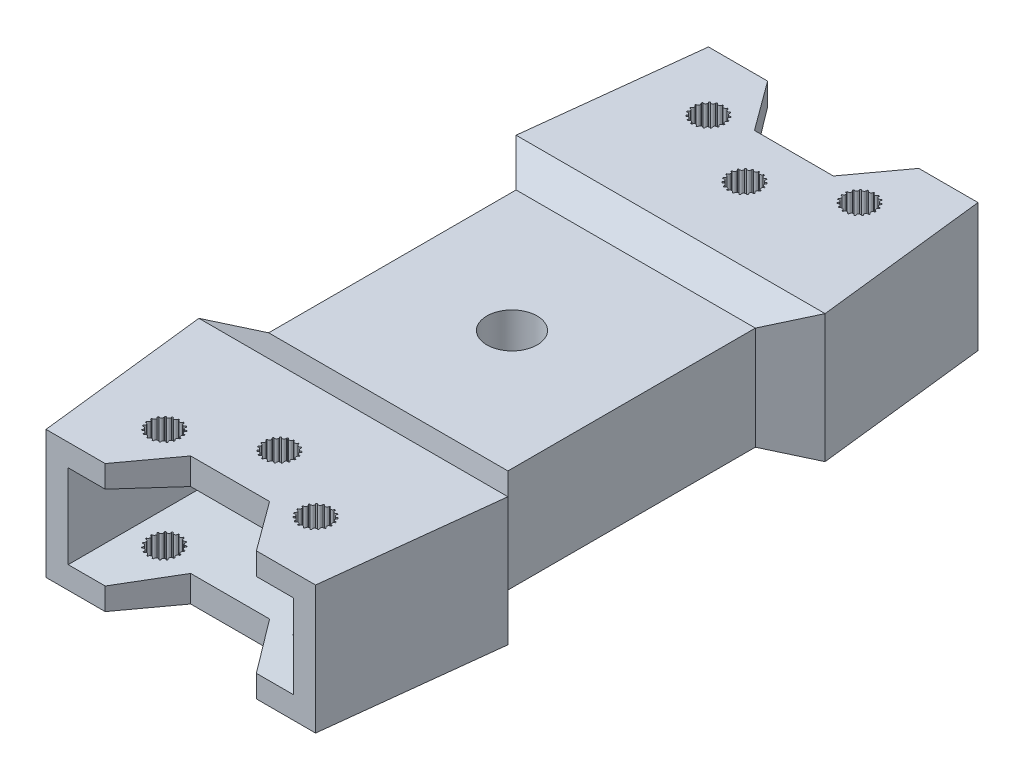
from build123d import *

# Parameters (mm, degrees)
SKETCH2_R               = 3
SKETCH2_R_2             = 5.1
BOSS_EXTRUDE1_DEPTH     = 26
SKETCH3_W               = 70
SKETCH3_H               = 16
CUT_EXTRUDE1_DEPTH      = 27.5
CUT_EXTRUDE2_DEPTH      = 63
SKETCH9_R               = 2
CUT_EXTRUDE3_DEPTH      = 68
SKETCH10_W              = 45.651038986
SKETCH10_H              = 17
CUT_EXTRUDE4_DEPTH      = 28
CUT_EXTRUDE4_DRAFT      = -5
MIRROR5_COPY_1_SKETCH_W = 45.651038986
MIRROR5_COPY_1_SKETCH_H = 17
MIRROR5_COPY_1_DEPTH    = 28
MIRROR5_COPY_1_DRAFT    = -5
CUT_EXTRUDE5_START      = -54
SKETCH11_R              = 2
CUT_EXTRUDE5_DEPTH      = 54
SKETCH12_R              = 8.5
CUT_EXTRUDE6_DEPTH      = 10


with BuildPart() as part:
    # Sketch2 → Boss-Extrude1 (new body)
    with BuildSketch(Plane(origin=(0, 0, 0), x_dir=(1, 0, 0), z_dir=(0, 1, 0))):
        with BuildLine():
            ThreePointArc((15, 350), (0, 365), (-15, 350))
            Line((-15, 350), (-31.325519493, 207.151704434))
            Line((-31.325519493, 207.151704434), (-24.254451681, 200.080636622))
            Line((-24.254451681, 200.080636622), (-24.254451681, 149.919363378))
            Line((-24.254451681, 149.919363378), (-31.325519493, 142.848295566))
            Line((-31.325519493, 142.848295566), (-15, 0))
            ThreePointArc((-15, 0), (0, -15), (15, 0))
            Line((15, 0), (31.325519493, 142.848295566))
            Line((31.325519493, 142.848295566), (24.254451681, 149.919363378))
            Line((24.254451681, 149.919363378), (24.254451681, 200.080636622))
            Line((24.254451681, 200.080636622), (31.325519493, 207.151704434))
            Line((31.325519493, 207.151704434), (15, 350))
        make_face()
        Circle(SKETCH2_R, mode=Mode.SUBTRACT)
        with Locations((0, 175)):
            Circle(SKETCH2_R_2, mode=Mode.SUBTRACT)
        with Locations((0, 350)):
            Circle(SKETCH2_R, mode=Mode.SUBTRACT)
    extrude(amount=BOSS_EXTRUDE1_DEPTH)

    # Sketch3 → Cut-Extrude1 (cut, symmetric)
    with BuildSketch(Plane(origin=(0, 0, 0), x_dir=(0, 0, -1), z_dir=(1, 0, 0))):
        with Locations((-15, 13)):
            Rectangle(SKETCH3_W, SKETCH3_H)
    cut_extrude1 = extrude(amount=CUT_EXTRUDE1_DEPTH, both=True, mode=Mode.SUBTRACT)

    # Sketch5 → Cut-Extrude2 (cut, symmetric)
    with BuildSketch(Plane(origin=(24.254451681, 0, 0), x_dir=(0, 0, -1), z_dir=(1, 0, 0))):
        Polygon((142.848295566, 26), (149.919363378, 23.456766037), (200.080636622, 23.456766037), (207.151704434, 26), align=None)
        Polygon((207.151704434, 0), (200.080636622, 2.543233963), (149.919363378, 2.543233963), (142.848295566, 0), align=None)
    extrude(amount=CUT_EXTRUDE2_DEPTH, both=True, mode=Mode.SUBTRACT)

    # Mirror3: Cut-Extrude1 across plane
    add(cut_extrude1.mirror(Plane.XY.offset(-175)), mode=Mode.SUBTRACT)

    # Sketch9 → Cut-Extrude3 (cut, symmetric)
    with BuildSketch(Plane(origin=(0, 23.456766037, 0), x_dir=(1, 0, 0), z_dir=(0, 1, 0))):
        with Locations((0, 127.848295566)):
            Circle(SKETCH9_R)
        with Locations((-15.325519493, 119.848295566)):
            Circle(SKETCH9_R)
        with Locations((15.325519493, 119.848295566)):
            Circle(SKETCH9_R)
        Polygon((-27.325519493, 107.848295566), (-15.325519493, 107.848295566), (-8, 117.848295566), (8, 117.848295566), (15.325519493, 107.848295566), (27.325519493, 107.848295566), (32.660886482, 107.848295566), (15.941481629, -24.730405263), (-17.738358912, -19.447293022), (-31.029707264, 97.91851296), align=None)
    cut_extrude3 = extrude(amount=CUT_EXTRUDE3_DEPTH, both=True, mode=Mode.SUBTRACT)


with BuildPart() as cut_extrude4_tool:
    # Sketch10 → Cut-Extrude4 (with draft: the straight prism first)
    with BuildSketch(Plane.XY.offset(-107.848295566)):
        with Locations((0, 13)):
            Rectangle(SKETCH10_W, SKETCH10_H)
    extrude(amount=-CUT_EXTRUDE4_DEPTH)
    # Cut-Extrude4: the draft: its side faces are tilted about the plane it starts from
    cut_extrude4_sides = [cut_extrude4_tool.faces().sort_by_distance(p)[0] for p in [
        (-22.825519493, 13, -121.848295566),
        (0, 4.5, -121.848295566),
        (22.825519493, 13, -121.848295566),
        (0, 21.5, -121.848295566),
    ]]
    draft(cut_extrude4_sides, Plane.XY.offset(-107.848295566), CUT_EXTRUDE4_DRAFT)


with BuildPart() as part_1:
    add(part.part)

    # Cut-Extrude4: cut by cut_extrude4_tool
    add(cut_extrude4_tool.part, mode=Mode.SUBTRACT)

    # Mirror5: Cut-Extrude3 across plane
    add(cut_extrude3.mirror(Plane.XY.offset(-175)), mode=Mode.SUBTRACT)


with BuildPart() as mirror5_copy_1_tool:
    # Mirror5 copy 1 sketch → Mirror5 copy 1 (with draft: the straight prism first)
    with BuildSketch(Plane(origin=(0, 0, -242.151704434), x_dir=(1, 0, 0), z_dir=(0, 0, -1))):
        with Locations((0, -13)):
            Rectangle(MIRROR5_COPY_1_SKETCH_W, MIRROR5_COPY_1_SKETCH_H)
    extrude(amount=-MIRROR5_COPY_1_DEPTH)
    # Mirror5 copy 1: the draft: its side faces are tilted about the plane it starts from
    mirror5_copy_1_sides = [mirror5_copy_1_tool.faces().sort_by_distance(p)[0] for p in [
        (-22.825519493, 13, -228.151704434),
        (0, 4.5, -228.151704434),
        (22.825519493, 13, -228.151704434),
        (0, 21.5, -228.151704434),
    ]]
    draft(mirror5_copy_1_sides, Plane(origin=(0, 0, -242.151704434), x_dir=(1, 0, 0), z_dir=(0, 0, -1)), MIRROR5_COPY_1_DRAFT)


with BuildPart() as part_2:
    add(part_1.part)

    # Mirror5 copy 1: cut by mirror5_copy_1_tool
    add(mirror5_copy_1_tool.part, mode=Mode.SUBTRACT)

    # Sketch11 → Cut-Extrude5 (cut)
    # profile 1 of 3: a face of its own
    with BuildSketch(Plane.XZ.offset(CUT_EXTRUDE5_START)):
        with BuildLine():
            ThreePointArc((-12.078411866, -119.985379679), (-12.075519493, -119.848295566), (-12.078411866, -119.711211453))
            ThreePointArc((-12.078411866, -119.711211453), (-12.514389779, -119.379200984), (-12.209837975, -118.923617961))
            ThreePointArc((-12.209837975, -118.923617961), (-12.251613458, -118.793022291), (-12.298860252, -118.664304925))
            ThreePointArc((-12.298860252, -118.664304925), (-12.819019302, -118.491845496), (-12.678896521, -117.962059408))
            ThreePointArc((-12.678896521, -117.962059408), (-12.760812838, -117.85210425), (-12.847294131, -117.745702155))
            ThreePointArc((-12.847294131, -117.745702155), (-13.395267014, -117.751482421), (-13.434757733, -117.204903812))
            ThreePointArc((-13.434757733, -117.204903812), (-13.547937979, -117.127504512), (-13.664282181, -117.054948006))
            ThreePointArc((-13.664282181, -117.054948006), (-14.180687533, -117.238341585), (-14.39551232, -116.734200728))
            ThreePointArc((-14.39551232, -116.734200728), (-14.52769166, -116.697744702), (-14.661291071, -116.666896408))
            ThreePointArc((-14.661291071, -116.666896408), (-15.090168359, -117.008029761), (-15.457047615, -116.600958141))
            ThreePointArc((-15.457047615, -116.600958141), (-15.593902366, -116.609395964), (-15.730279417, -116.623598773))
            ThreePointArc((-15.730279417, -116.623598773), (-16.025153132, -117.085504808), (-16.504329796, -116.819614951))
            ThreePointArc((-16.504329796, -116.819614951), (-16.631029623, -116.872032254), (-16.755405745, -116.929747073))
            ThreePointArc((-16.755405745, -116.929747073), (-16.884321744, -117.462371103), (-17.423869591, -117.3664763))
            ThreePointArc((-17.423869591, -117.3664763), (-17.526684601, -117.457192856), (-17.62558171, -117.552165387))
            ThreePointArc((-17.62558171, -117.552165387), (-17.574569945, -118.097789335), (-18.116020593, -118.182281277))
            ThreePointArc((-18.116020593, -118.182281277), (-18.183809185, -118.301466539), (-18.246510245, -118.423405035))
            ThreePointArc((-18.246510245, -118.423405035), (-18.021098632, -118.922902079), (-18.505777502, -119.178624752))
            ThreePointArc((-18.505777502, -119.178624752), (-18.531193729, -119.313363148), (-18.550904109, -119.449053681))
            ThreePointArc((-18.550904109, -119.449053681), (-18.175519493, -119.848295566), (-18.550904109, -120.247537451))
            ThreePointArc((-18.550904109, -120.247537451), (-18.531193729, -120.383227984), (-18.505777502, -120.51796638))
            ThreePointArc((-18.505777502, -120.51796638), (-18.021098632, -120.773689053), (-18.246510245, -121.273186097))
            ThreePointArc((-18.246510245, -121.273186097), (-18.183809185, -121.395124593), (-18.116020593, -121.514309855))
            ThreePointArc((-18.116020593, -121.514309855), (-17.574569945, -121.598801797), (-17.62558171, -122.144425745))
            ThreePointArc((-17.62558171, -122.144425745), (-17.526684601, -122.239398276), (-17.423869591, -122.330114832))
            ThreePointArc((-17.423869591, -122.330114832), (-16.884321744, -122.234220029), (-16.755405745, -122.766844059))
            ThreePointArc((-16.755405745, -122.766844059), (-16.631029623, -122.824558878), (-16.504329796, -122.876976181))
            ThreePointArc((-16.504329796, -122.876976181), (-16.025153132, -122.611086324), (-15.730279417, -123.072992359))
            ThreePointArc((-15.730279417, -123.072992359), (-15.593902366, -123.087195168), (-15.457047615, -123.095632991))
            ThreePointArc((-15.457047615, -123.095632991), (-15.090168359, -122.688561371), (-14.661291071, -123.029694724))
            ThreePointArc((-14.661291071, -123.029694724), (-14.52769166, -122.99884643), (-14.39551232, -122.962390404))
            ThreePointArc((-14.39551232, -122.962390404), (-14.180687533, -122.458249547), (-13.664282181, -122.641643126))
            ThreePointArc((-13.664282181, -122.641643126), (-13.547937979, -122.56908662), (-13.434757733, -122.49168732))
            ThreePointArc((-13.434757733, -122.49168732), (-13.395267014, -121.945108711), (-12.847294131, -121.950888977))
            ThreePointArc((-12.847294131, -121.950888977), (-12.760812838, -121.844486882), (-12.678896521, -121.734531724))
            ThreePointArc((-12.678896521, -121.734531724), (-12.819019302, -121.204745636), (-12.298860252, -121.032286207))
            ThreePointArc((-12.298860252, -121.032286207), (-12.251613458, -120.903568841), (-12.209837975, -120.772973171))
            ThreePointArc((-12.209837975, -120.772973171), (-12.514389779, -120.317390148), (-12.078411866, -119.985379679))
        make_face()
        with Locations((-15.325519493, -119.848295566)):
            Circle(SKETCH11_R, mode=Mode.SUBTRACT)
    # profile 2 of 3: a face of its own
    with BuildSketch(Plane.XZ.offset(CUT_EXTRUDE5_START)):
        with BuildLine():
            ThreePointArc((3.247107628, -127.985379679), (3.25, -127.848295566), (3.247107628, -127.711211453))
            ThreePointArc((3.247107628, -127.711211453), (2.811129715, -127.379200984), (3.115681519, -126.923617961))
            ThreePointArc((3.115681519, -126.923617961), (3.073906036, -126.793022291), (3.026659241, -126.664304925))
            ThreePointArc((3.026659241, -126.664304925), (2.506500191, -126.491845496), (2.646622972, -125.962059408))
            ThreePointArc((2.646622972, -125.962059408), (2.564706656, -125.85210425), (2.478225362, -125.745702155))
            ThreePointArc((2.478225362, -125.745702155), (1.930252479, -125.751482421), (1.89076176, -125.204903812))
            ThreePointArc((1.89076176, -125.204903812), (1.777581514, -125.127504512), (1.661237312, -125.054948006))
            ThreePointArc((1.661237312, -125.054948006), (1.14483196, -125.238341585), (0.930007173, -124.734200728))
            ThreePointArc((0.930007173, -124.734200728), (0.797827833, -124.697744702), (0.664228422, -124.666896408))
            ThreePointArc((0.664228422, -124.666896408), (0.235351135, -125.008029761), (-0.131528121, -124.600958141))
            ThreePointArc((-0.131528121, -124.600958141), (-0.268382873, -124.609395964), (-0.404759924, -124.623598773))
            ThreePointArc((-0.404759924, -124.623598773), (-0.699633638, -125.085504808), (-1.178810303, -124.819614951))
            ThreePointArc((-1.178810303, -124.819614951), (-1.30551013, -124.872032254), (-1.429886252, -124.929747073))
            ThreePointArc((-1.429886252, -124.929747073), (-1.558802251, -125.462371103), (-2.098350098, -125.3664763))
            ThreePointArc((-2.098350098, -125.3664763), (-2.201165108, -125.457192856), (-2.300062217, -125.552165387))
            ThreePointArc((-2.300062217, -125.552165387), (-2.249050452, -126.097789335), (-2.7905011, -126.182281277))
            ThreePointArc((-2.7905011, -126.182281277), (-2.858289691, -126.301466539), (-2.920990752, -126.423405035))
            ThreePointArc((-2.920990752, -126.423405035), (-2.695579139, -126.922902079), (-3.180258009, -127.178624752))
            ThreePointArc((-3.180258009, -127.178624752), (-3.205674236, -127.313363148), (-3.225384615, -127.449053681))
            ThreePointArc((-3.225384615, -127.449053681), (-2.85, -127.848295566), (-3.225384615, -128.247537451))
            ThreePointArc((-3.225384615, -128.247537451), (-3.205674236, -128.383227984), (-3.180258009, -128.51796638))
            ThreePointArc((-3.180258009, -128.51796638), (-2.695579139, -128.773689053), (-2.920990752, -129.273186097))
            ThreePointArc((-2.920990752, -129.273186097), (-2.858289691, -129.395124593), (-2.7905011, -129.514309855))
            ThreePointArc((-2.7905011, -129.514309855), (-2.249050452, -129.598801797), (-2.300062217, -130.144425745))
            ThreePointArc((-2.300062217, -130.144425745), (-2.201165108, -130.239398276), (-2.098350098, -130.330114832))
            ThreePointArc((-2.098350098, -130.330114832), (-1.558802251, -130.234220029), (-1.429886252, -130.766844059))
            ThreePointArc((-1.429886252, -130.766844059), (-1.30551013, -130.824558878), (-1.178810303, -130.876976181))
            ThreePointArc((-1.178810303, -130.876976181), (-0.699633638, -130.611086324), (-0.404759924, -131.072992359))
            ThreePointArc((-0.404759924, -131.072992359), (-0.268382873, -131.087195168), (-0.131528121, -131.095632991))
            ThreePointArc((-0.131528121, -131.095632991), (0.235351135, -130.688561371), (0.664228422, -131.029694724))
            ThreePointArc((0.664228422, -131.029694724), (0.797827833, -130.99884643), (0.930007173, -130.962390404))
            ThreePointArc((0.930007173, -130.962390404), (1.14483196, -130.458249547), (1.661237312, -130.641643126))
            ThreePointArc((1.661237312, -130.641643126), (1.777581514, -130.56908662), (1.89076176, -130.49168732))
            ThreePointArc((1.89076176, -130.49168732), (1.930252479, -129.945108711), (2.478225362, -129.950888977))
            ThreePointArc((2.478225362, -129.950888977), (2.564706656, -129.844486882), (2.646622972, -129.734531724))
            ThreePointArc((2.646622972, -129.734531724), (2.506500191, -129.204745636), (3.026659241, -129.032286207))
            ThreePointArc((3.026659241, -129.032286207), (3.073906036, -128.903568841), (3.115681519, -128.772973171))
            ThreePointArc((3.115681519, -128.772973171), (2.811129715, -128.317390148), (3.247107628, -127.985379679))
        make_face()
        with Locations((0, -127.848295566)):
            Circle(SKETCH11_R, mode=Mode.SUBTRACT)
    # profile 3 of 3: a face of its own
    with BuildSketch(Plane.XZ.offset(CUT_EXTRUDE5_START)):
        with BuildLine():
            ThreePointArc((18.572627121, -119.985379679), (18.575519493, -119.848295566), (18.572627121, -119.711211453))
            ThreePointArc((18.572627121, -119.711211453), (18.136649208, -119.379200984), (18.441201012, -118.923617961))
            ThreePointArc((18.441201012, -118.923617961), (18.399425529, -118.793022291), (18.352178734, -118.664304925))
            ThreePointArc((18.352178734, -118.664304925), (17.832019684, -118.491845496), (17.972142466, -117.962059408))
            ThreePointArc((17.972142466, -117.962059408), (17.890226149, -117.85210425), (17.803744856, -117.745702155))
            ThreePointArc((17.803744856, -117.745702155), (17.255771972, -117.751482421), (17.216281254, -117.204903812))
            ThreePointArc((17.216281254, -117.204903812), (17.103101007, -117.127504512), (16.986756805, -117.054948006))
            ThreePointArc((16.986756805, -117.054948006), (16.470351454, -117.238341585), (16.255526667, -116.734200728))
            ThreePointArc((16.255526667, -116.734200728), (16.123347326, -116.697744702), (15.989747915, -116.666896408))
            ThreePointArc((15.989747915, -116.666896408), (15.560870628, -117.008029761), (15.193991372, -116.600958141))
            ThreePointArc((15.193991372, -116.600958141), (15.05713662, -116.609395964), (14.920759569, -116.623598773))
            ThreePointArc((14.920759569, -116.623598773), (14.625885855, -117.085504808), (14.14670919, -116.819614951))
            ThreePointArc((14.14670919, -116.819614951), (14.020009363, -116.872032254), (13.895633242, -116.929747073))
            ThreePointArc((13.895633242, -116.929747073), (13.766717243, -117.462371103), (13.227169396, -117.3664763))
            ThreePointArc((13.227169396, -117.3664763), (13.124354385, -117.457192856), (13.025457276, -117.552165387))
            ThreePointArc((13.025457276, -117.552165387), (13.076469041, -118.097789335), (12.535018394, -118.182281277))
            ThreePointArc((12.535018394, -118.182281277), (12.467229802, -118.301466539), (12.404528741, -118.423405035))
            ThreePointArc((12.404528741, -118.423405035), (12.629940354, -118.922902079), (12.145261485, -119.178624752))
            ThreePointArc((12.145261485, -119.178624752), (12.119845257, -119.313363148), (12.100134878, -119.449053681))
            ThreePointArc((12.100134878, -119.449053681), (12.475519493, -119.848295566), (12.100134878, -120.247537451))
            ThreePointArc((12.100134878, -120.247537451), (12.119845257, -120.383227984), (12.145261485, -120.51796638))
            ThreePointArc((12.145261485, -120.51796638), (12.629940354, -120.773689053), (12.404528741, -121.273186097))
            ThreePointArc((12.404528741, -121.273186097), (12.467229802, -121.395124593), (12.535018394, -121.514309855))
            ThreePointArc((12.535018394, -121.514309855), (13.076469041, -121.598801797), (13.025457276, -122.144425745))
            ThreePointArc((13.025457276, -122.144425745), (13.124354385, -122.239398276), (13.227169396, -122.330114832))
            ThreePointArc((13.227169396, -122.330114832), (13.766717243, -122.234220029), (13.895633242, -122.766844059))
            ThreePointArc((13.895633242, -122.766844059), (14.020009363, -122.824558878), (14.14670919, -122.876976181))
            ThreePointArc((14.14670919, -122.876976181), (14.625885855, -122.611086324), (14.920759569, -123.072992359))
            ThreePointArc((14.920759569, -123.072992359), (15.05713662, -123.087195168), (15.193991372, -123.095632991))
            ThreePointArc((15.193991372, -123.095632991), (15.560870628, -122.688561371), (15.989747915, -123.029694724))
            ThreePointArc((15.989747915, -123.029694724), (16.123347326, -122.99884643), (16.255526667, -122.962390404))
            ThreePointArc((16.255526667, -122.962390404), (16.470351454, -122.458249547), (16.986756805, -122.641643126))
            ThreePointArc((16.986756805, -122.641643126), (17.103101007, -122.56908662), (17.216281254, -122.49168732))
            ThreePointArc((17.216281254, -122.49168732), (17.255771972, -121.945108711), (17.803744856, -121.950888977))
            ThreePointArc((17.803744856, -121.950888977), (17.890226149, -121.844486882), (17.972142466, -121.734531724))
            ThreePointArc((17.972142466, -121.734531724), (17.832019684, -121.204745636), (18.352178734, -121.032286207))
            ThreePointArc((18.352178734, -121.032286207), (18.399425529, -120.903568841), (18.441201012, -120.772973171))
            ThreePointArc((18.441201012, -120.772973171), (18.136649208, -120.317390148), (18.572627121, -119.985379679))
        make_face()
        with Locations((15.325519493, -119.848295566)):
            Circle(SKETCH11_R, mode=Mode.SUBTRACT)
    cut_extrude5 = extrude(amount=CUT_EXTRUDE5_DEPTH, mode=Mode.SUBTRACT)

    # Mirror6: Cut-Extrude5 across plane
    add(cut_extrude5.mirror(Plane.XY.offset(-175)), mode=Mode.SUBTRACT)

    # Sketch12 → Cut-Extrude6 (cut)
    with BuildSketch(Plane.XZ.offset(-2.543233963)):
        with Locations((0, -175)):
            Circle(SKETCH12_R)
    extrude(amount=-CUT_EXTRUDE6_DEPTH, mode=Mode.SUBTRACT)


solid = part_2.part
